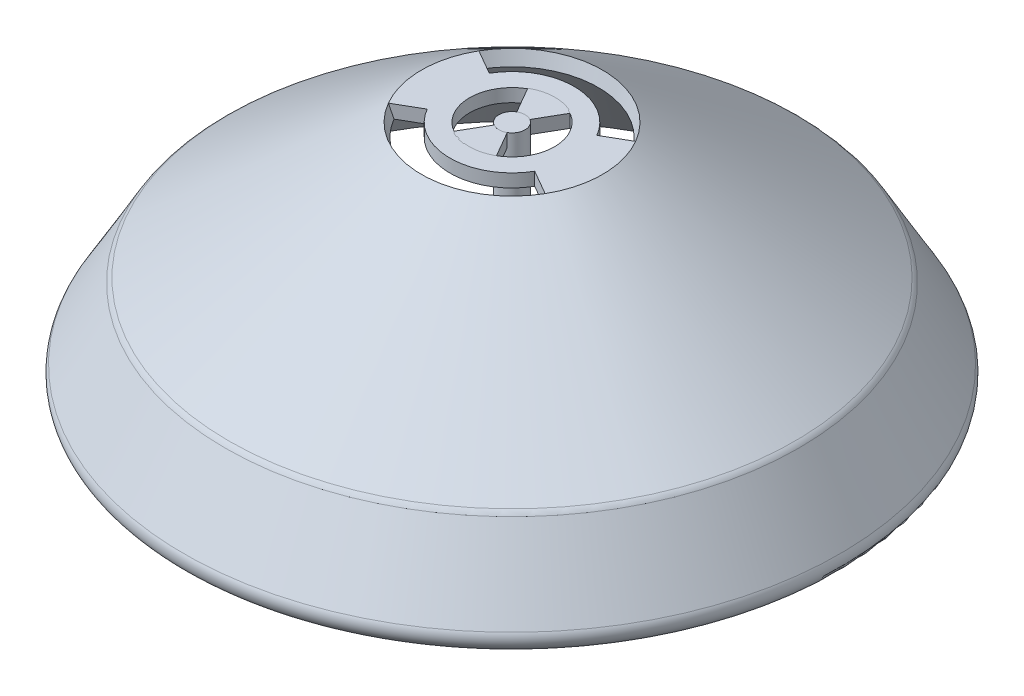
from build123d import *
from build123d.topology import SkipClean

# Parameters (mm, degrees)
REVOLVE5_ANGLE  = 90
SKETCH1_24_W    = 2.54
SKETCH1_24_H    = 25.908
SKETCH1_24_H_2  = 2.54
SKETCH1_24_W_2  = 3.81
REVOLVE9_ANGLE  = 60
SKETCH2_W       = 5.842
SKETCH2_H       = 2.54
REVOLVE10_ANGLE = 60
FILLET1_R       = 2.54
FILLET2_R       = 2.54


with BuildPart() as part:
    # Sketch1 → Revolve4 (revolve)
    with BuildSketch(Plane.XY, mode=Mode.PRIVATE) as revolve4_sk:
        Polygon((9.525, 101.6), (9.525, 104.902), (2.54, 104.902), (0, 104.902), (0, 101.6), (6.35, 101.6), align=None)
    revolve(revolve4_sk.sketch.rotate(Axis((0, 133.35, 0), (0, -1, 0)), 90), axis=Axis((0, 133.35, 0), (0, -1, 0)))

    # Sketch1<21> → Revolve5 (revolve, symmetric)
    with SkipClean():  # the faces are left unmerged after this step: merging them gives an invalid solid
        with BuildSketch(Plane.XY) as revolve5_sk:
            Polygon((9.525, 95.25), (9.525, 101.6), (6.35, 101.6), (6.35, 97.79), (3.683, 97.79), (3.683, 95.25), align=None)
            Polygon((-6.35, 97.79), (-6.35, 101.6), (-9.525, 101.6), (-9.525, 95.25), (-3.683, 95.25), (-3.683, 97.79), align=None)
        revolve(axis=Axis((0, 133.35, 0), (0, -1, 0)), revolution_arc=REVOLVE5_ANGLE / 2)
        revolve(revolve5_sk.sketch, axis=Axis((0, 133.35, 0), (0, 1, 0)), revolution_arc=REVOLVE5_ANGLE / 2)
    add(part.part.scale(1), mode=Mode.REPLACE)  # the faces are merged on a copy

    # Sketch1<24> → Revolve7 (revolve)
    with BuildSketch(Plane.XY, mode=Mode.PRIVATE) as revolve7_sk:
        with Locations((1.27, 117.856)):
            Rectangle(SKETCH1_24_W, SKETCH1_24_H)
        with Locations((1.27, 132.08)):
            Rectangle(SKETCH1_24_W, SKETCH1_24_H_2)
        Polygon((53.510192793, 105.094916695), (62.753640571, 89.084795506), (64.953345097, 90.354795506), (55.428345097, 106.852579448), (17.586106751, 133.35), (16.785247828, 130.81), align=None)
        with Locations((10.16, 132.08)):
            Rectangle(SKETCH1_24_W_2, SKETCH1_24_H_2)
    revolve(revolve7_sk.sketch.rotate(Axis((0, 133.35, 0), (0, -1, 0)), 270), axis=Axis((0, 133.35, 0), (0, -1, 0)))


with BuildPart() as revolve7_piece_1:
    # of the separate pieces the step leaves, piece 1, a body of its own (revolve7_pieces)
    add(part.part.solids().sort_by_distance((0, 105.094916695, -53.510192793))[0])



with BuildPart() as revolve7_piece_2:
    # of the separate pieces the step leaves, piece 2, a body of its own (revolve7_pieces)
    add(part.part.solids().sort_by_distance((0, 101.6, 9.525))[0])


with BuildPart() as revolve7_piece_3:
    # of the separate pieces the step leaves, piece 3, a body of its own (revolve7_pieces)
    add(part.part.solids().sort_by_distance((0, 133.35, -8.255))[0])


with BuildPart() as revolve7_piece_1_1:
    add(revolve7_piece_1.part)

    add(revolve7_piece_3.part)  # Revolve9 merges Revolve7 piece 3
    # Sketch1<29> → Revolve9 (revolve, symmetric)
    with BuildSketch(Plane.XY) as revolve9_sk:
        Polygon((12.065, 133.35), (12.065, 130.81), (16.785247828, 130.81), (17.586106751, 133.35), align=None)
        Polygon((-16.785247828, 130.81), (-12.065, 130.81), (-12.065, 133.35), (-17.586106751, 133.35), align=None)
    revolve(axis=Axis((0, 133.35, 0), (0, -1, 0)), revolution_arc=REVOLVE9_ANGLE / 2)
    revolve(revolve9_sk.sketch, axis=Axis((0, 133.35, 0), (0, 1, 0)), revolution_arc=REVOLVE9_ANGLE / 2)

    # Fillet1
    fillet1_edges = [revolve7_piece_1_1.edges().sort_by_distance(p)[0] for p in [
        (0, 90.354795506, 64.953345097),
    ]]
    fillet(fillet1_edges, radius=FILLET1_R - 0.0001)  # a hair under: the kernel refuses the full size

    # Fillet2
    fillet2_edges = [revolve7_piece_1_1.edges().sort_by_distance(p)[0] for p in [
        (0, 106.852579448, 55.428345097),
    ]]
    fillet(fillet2_edges, radius=FILLET2_R)


with BuildPart() as body_3:
    # Sketch2 → Revolve10 (revolve, symmetric)
    with BuildSketch(Plane(origin=(0, 0, 0), x_dir=(0, 0, -1), z_dir=(1, 0, 0))) as revolve10_sk:
        with Locations((-5.461, 132.08)):
            Rectangle(SKETCH2_W, SKETCH2_H)
        with Locations((5.461, 132.08)):
            Rectangle(SKETCH2_W, SKETCH2_H)
    revolve(axis=Axis((0, 133.35, 0), (0, -1, 0)), revolution_arc=REVOLVE10_ANGLE / 2)
    revolve(revolve10_sk.sketch, axis=Axis((0, 133.35, 0), (0, 1, 0)), revolution_arc=REVOLVE10_ANGLE / 2)


solid = Compound([revolve7_piece_2.part, revolve7_piece_1_1.part, body_3.part])
